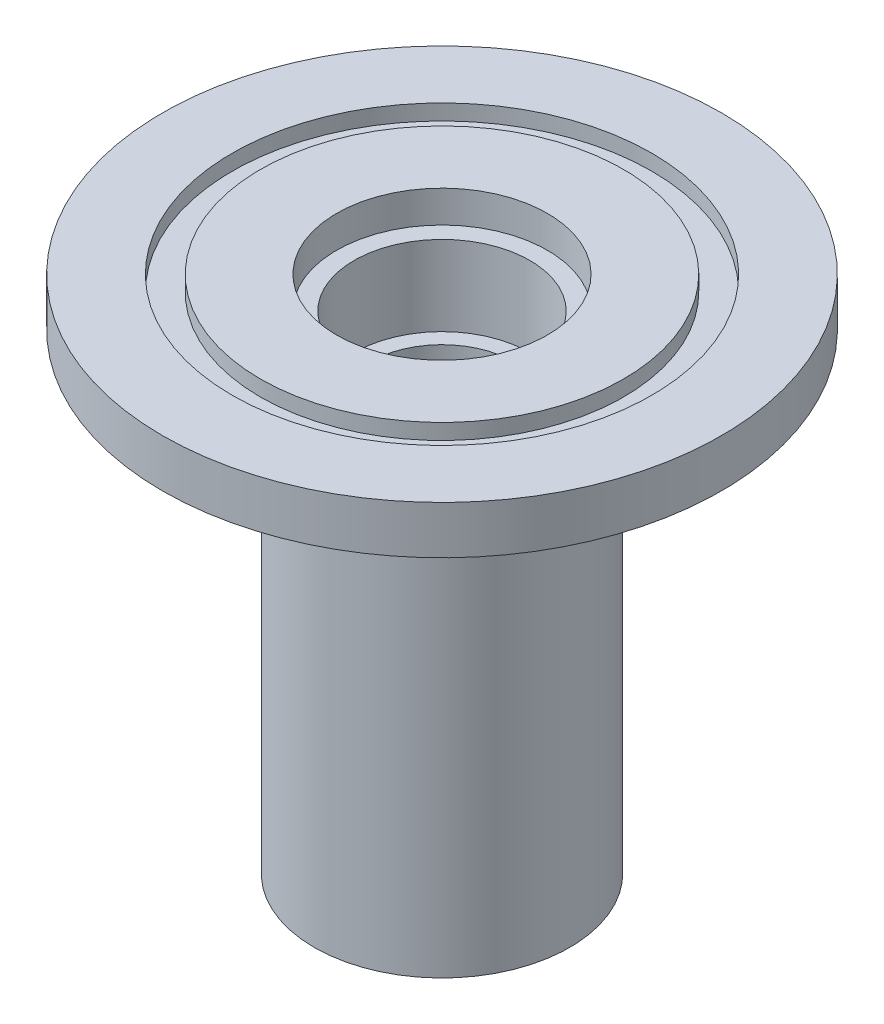
from build123d import *


with BuildPart() as part:
    # Sketch1 → Revolve1 (revolve)
    with BuildSketch(Plane.XY):
        Polygon((35, 0), (26.2636, 0), (26.2636, -1.9558), (22.733, -1.9558), (22.733, 0), (13.2, 0), (13.2, -4), (11, -4), (11, -14), (9, -14), (9, -17), (11, -17), (11, -30.5), (12.5, -30.5), (12.5, -65), (16, -65), (16, -6), (35, -6), align=None)
    revolve(axis=Axis((0, 0, 0), (0, -1, 0)))


solid = part.part
